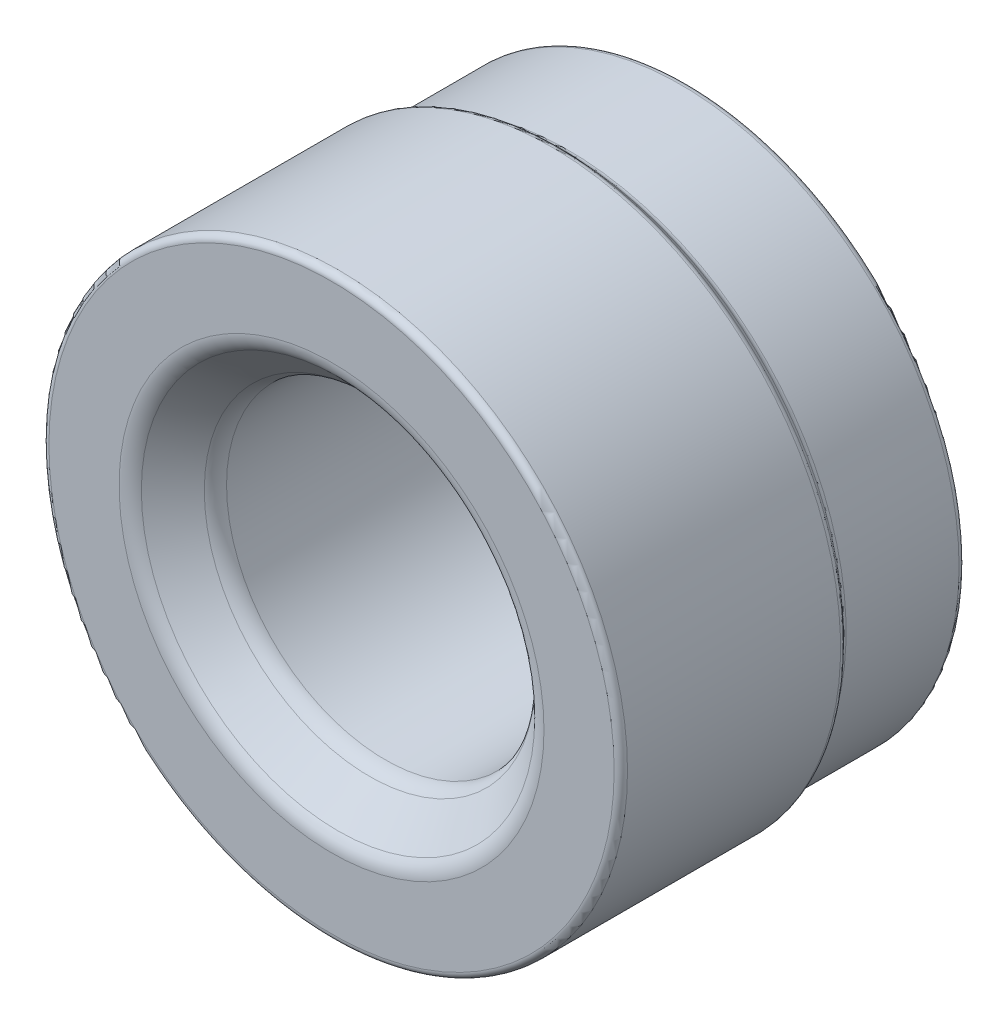
from build123d import *

# Parameters (mm, degrees)
SKETCH1_R           = 5
BOSS_EXTRUDE1_DEPTH = 2.76
SKETCH4_R           = 12.5
BOSS_EXTRUDE2_DEPTH = 6
SKETCH5_R           = 13
BOSS_EXTRUDE3_DEPTH = 10
FILLET2_R           = 0.3
FILLET3_R           = 0.3
SKETCH6_R           = 7.132829082
CUT_EXTRUDE1_DEPTH  = 31
CHAMFER1_SIZE       = 2
FILLET4_R           = 1
CHAMFER3_SIZE       = 0.5
FILLET7_R           = 0.3


with BuildPart() as part:
    # Sketch1 → Boss-Extrude1 (new body)
    with BuildSketch(Plane.XY):
        Circle(SKETCH1_R)
    extrude(amount=BOSS_EXTRUDE1_DEPTH)

    # Sketch4 → Boss-Extrude2 (add)
    with BuildSketch(Plane.XY.offset(2.76)):
        Circle(SKETCH4_R)
    extrude(amount=BOSS_EXTRUDE2_DEPTH)

    # Sketch5 → Boss-Extrude3 (add)
    with BuildSketch(Plane.XY.offset(8.76)):
        Circle(SKETCH5_R)
    extrude(amount=BOSS_EXTRUDE3_DEPTH)

    # Fillet2
    fillet2_edges = [part.edges().sort_by_distance(p)[0] for p in [
        (-5, 0, 2.76),
    ]]
    fillet(fillet2_edges, radius=FILLET2_R)

    # Fillet3
    fillet3_edges = [part.edges().sort_by_distance(p)[0] for p in [
        (-13, 0, 18.76),
    ]]
    fillet(fillet3_edges, radius=FILLET3_R)

    # Sketch6 → Cut-Extrude1 (cut)
    with BuildSketch(Plane.XY.offset(18.76)):
        Circle(SKETCH6_R)
    extrude(amount=-CUT_EXTRUDE1_DEPTH, mode=Mode.SUBTRACT)

    # Chamfer1
    chamfer1_edges = [part.edges().sort_by_distance(p)[0] for p in [
        (-7.132829082, 0, 2.76),
        (-7.132829082, 0, 18.76),
    ]]
    chamfer(chamfer1_edges, length=CHAMFER1_SIZE)

    # Fillet4
    fillet4_edges = [part.edges().sort_by_distance(p)[0] for p in [
        (-9.132829082, 0, 2.76),
        (-7.132829082, 0, 16.76),
        (-7.132829082, 0, 4.76),
        (-9.132829082, 0, 18.76),
    ]]
    fillet(fillet4_edges, radius=FILLET4_R)

    # Chamfer3
    chamfer3_edges = [part.edges().sort_by_distance(p)[0] for p in [
        (-12.5, 0, 8.76),
    ]]
    chamfer(chamfer3_edges, length=CHAMFER3_SIZE - 0.0001)  # a hair under: the kernel refuses the full size

    # Fillet6: read off the stored shape, not the designer's step
    # Fillet6 outline → Fillet6 (revolve, cut)
    with BuildSketch(Plane.XZ):
        with BuildLine():
            Line((13, 8.672132034), (13, 8.884264069))
            ThreePointArc((13, 8.884264069), (12.97716386, 8.769459039), (12.912132034, 8.672132034))
            Line((12.912132034, 8.672132034), (13, 8.672132034))
        make_face()
    revolve(axis=Axis((0, 0, 0), (0, 0, 1)), mode=Mode.SUBTRACT)

    # Fillet6 2 outline → Fillet6 2 (revolve)
    with BuildSketch(Plane.XZ):
        with BuildLine():
            ThreePointArc((12.5, 8.135735931), (12.52283614, 8.250540961), (12.587867966, 8.347867966))
            Line((12.587867966, 8.347867966), (12.5, 8.347867966))
            Line((12.5, 8.347867966), (12.5, 8.135735931))
        make_face()
    revolve(axis=Axis((0, 0, 0), (0, 0, 1)))

    # Fillet7
    fillet7_edges = [part.edges().sort_by_distance(p)[0] for p in [
        (-12.5, 0, 2.76),
    ]]
    fillet(fillet7_edges, radius=FILLET7_R)


solid = part.part
